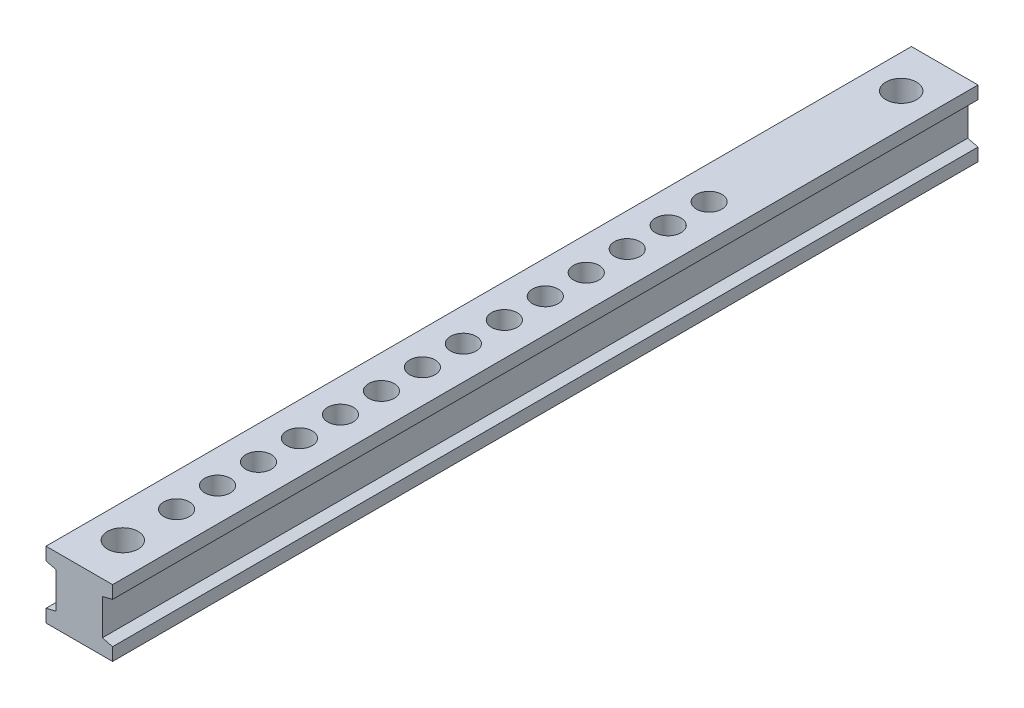
from build123d import *

# Parameters (mm, degrees)
BOSS_EXTRUDE1_DEPTH     = 84.5
CUT_EXTRUDE1_DEPTH      = 85.998529399
CUT_EXTRUDE1_DEPTH_BACK = 85.998529399
SKETCH2_R               = 3
SKETCH2_R_2             = 2.5


with BuildPart() as part:
    # Sketch1 → Boss-Extrude1 (new, symmetric)
    with BuildSketch(Plane.XY):
        Polygon((4.5, 3.5), (6.5, 4), (6.5, 6.5), (-6.5, 6.5), (-6.5, 4), (-4.5, 3.5), (-4.5, -3.5), (-6.5, -4), (-6.5, -6.5), (6.5, -6.5), (6.5, -4), (4.5, -3.5), align=None)
    extrude(amount=BOSS_EXTRUDE1_DEPTH, both=True)

    # Sketch2 → Cut-Extrude1 (cut, two sides: drawn at the far end of the back side and taken through both)
    with BuildSketch(Plane(origin=(0, 0, 0), x_dir=(1, 0, 0), z_dir=(0, 1, 0)).offset(-CUT_EXTRUDE1_DEPTH_BACK)):
        with Locations((0, 76)):
            Circle(SKETCH2_R)
        with Locations((0, -76)):
            Circle(SKETCH2_R)
        with Locations((0, -65.5)):
            Circle(SKETCH2_R_2)
        with Locations((0, -57.5)):
            Circle(SKETCH2_R_2)
        with Locations((0, -49.5)):
            Circle(SKETCH2_R_2)
        with Locations((0, -41.5)):
            Circle(SKETCH2_R_2)
        with Locations((0, -33.5)):
            Circle(SKETCH2_R_2)
        with Locations((0, -25.5)):
            Circle(SKETCH2_R_2)
        with Locations((0, -17.5)):
            Circle(SKETCH2_R_2)
        with Locations((0, -9.5)):
            Circle(SKETCH2_R_2)
        with Locations((0, -1.5)):
            Circle(SKETCH2_R_2)
        with Locations((0, 6.5)):
            Circle(SKETCH2_R_2)
        with Locations((0, 14.5)):
            Circle(SKETCH2_R_2)
        with Locations((0, 22.5)):
            Circle(SKETCH2_R_2)
        with Locations((0, 30.5)):
            Circle(SKETCH2_R_2)
        with Locations((0, 38.5)):
            Circle(SKETCH2_R_2)
    extrude(amount=CUT_EXTRUDE1_DEPTH + CUT_EXTRUDE1_DEPTH_BACK, mode=Mode.SUBTRACT)


solid = part.part
